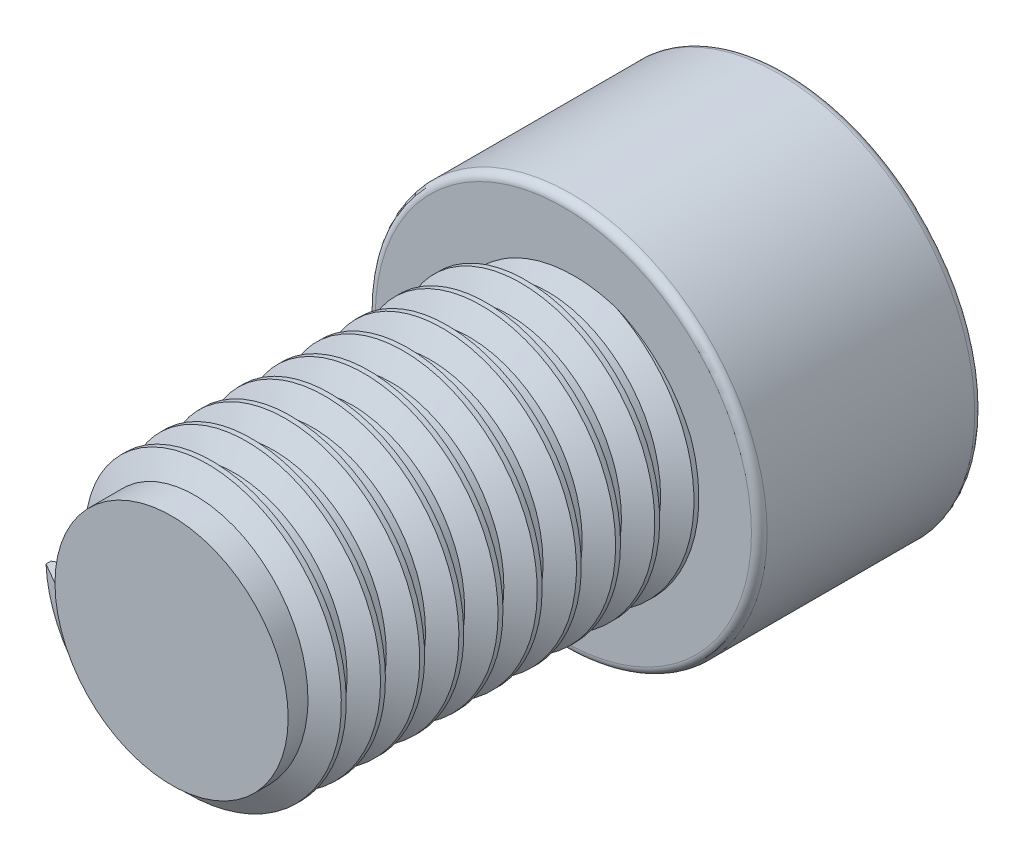
from build123d import *

# Parameters (mm, degrees)
SKETCH1_R           = 5
BOSS_EXTRUDE1_DEPTH = 5.7
SKETCH2_R           = 2.912497
CUT_EXTRUDE1_DEPTH  = 0.5
SKETCH3_R           = 2.976069
BOSS_EXTRUDE2_DEPTH = 10
FILLET1_R           = 0.2
THREAD1_PITCH       = 1


with BuildPart() as part:
    # Sketch1 → Boss-Extrude1 (new body)
    with BuildSketch(Plane.XY):
        Circle(SKETCH1_R)
        Polygon((0, 2.886751), (-2.5, 1.443376), (-2.5, -1.443376), (0, -2.886751), (2.5, -1.443376), (2.5, 1.443376), align=None, mode=Mode.SUBTRACT)
    extrude(amount=BOSS_EXTRUDE1_DEPTH)

    # Sketch2 → Cut-Extrude1 (cut)
    with BuildSketch(Plane(origin=(0, 0, 0), x_dir=(-1, 0, 0), z_dir=(0, 0, -1))):
        Circle(SKETCH2_R)
    extrude(amount=-CUT_EXTRUDE1_DEPTH, mode=Mode.SUBTRACT)

    # Sketch3 → Boss-Extrude2 (add)
    with BuildSketch(Plane.XY.offset(5.7)):
        Circle(SKETCH3_R)
    extrude(amount=BOSS_EXTRUDE2_DEPTH)

    # Fillet1
    fillet1_edges = [part.edges().sort_by_distance(p)[0] for p in [
        (-5, 0, 0),
        (-5, 0, 5.7),
    ]]
    fillet(fillet1_edges, radius=FILLET1_R)

    # Thread1: the profile of Thread Profile1 profile screwed along a left-hand helix of 10 turns, 8 arcs to a turn; built about Z, then put on its axis
    thread1_z = Axis((0, 0, 0), (0, 0, 1))
    thread1_corners = [(2.975769, 0, -0.000173), (3.517334, 0, 0.3125), (3.517334, 0, 0.4375), (2.975769, 0, 0.750173)]
    with BuildLine(mode=Mode.PRIVATE) as thread1_profile:
        Line(thread1_corners[0], thread1_corners[1])
        Line(thread1_corners[1], thread1_corners[2])
        Line(thread1_corners[2], thread1_corners[3])
        Line(thread1_corners[3], thread1_corners[0])
    thread1_cap = Face(thread1_profile.wire())
    thread1_turn_angles = [0, -22.5, -45, -67.5, -90, -112.5, -135, -157.5, -180, -202.5, -225, -247.5, -270, -292.5, -315, -337.5, -360]
    thread1_turn_weights = [1, 0.9238795325112867, 1, 0.9238795325112867, 1, 0.9238795325112867, 1, 0.9238795325112867, 1, 0.9238795325112867, 1, 0.9238795325112867, 1, 0.9238795325112867, 1, 0.9238795325112867, 1]
    thread1_turn_rails = [Edge.make_bspline([Vector(p[0], p[1], 0).rotate(thread1_z, thread1_turn_angles[k]) / thread1_turn_weights[k] + Vector(0, 0, p[2] + -THREAD1_PITCH * thread1_turn_angles[k] / 360) for k in range(17)], [0, 0, 0, 1, 1, 2, 2, 3, 3, 4, 4, 5, 5, 6, 6, 7, 7, 8, 8, 8], 2, thread1_turn_weights) for p in thread1_corners]
    thread1_turn_sides = [Face.make_surface_from_curves(thread1_turn_rails[p[0]], thread1_turn_rails[p[1]]) for p in [(0, 1), (1, 2), (2, 3), (3, 0)]]
    thread1 = Plane(origin=(0, 0, 15.7), x_dir=(-1, 0, 0), z_dir=(0, 0, -1)) * Solid(Shell([*[p.moved(Location((0, 0, THREAD1_PITCH * i))) for i in range(10) for p in thread1_turn_sides], thread1_cap, thread1_cap.rotate(thread1_z, -3600).moved(Location((0, 0, -THREAD1_PITCH * -3600 / 360)))]))
    add(thread1)


solid = part.part
